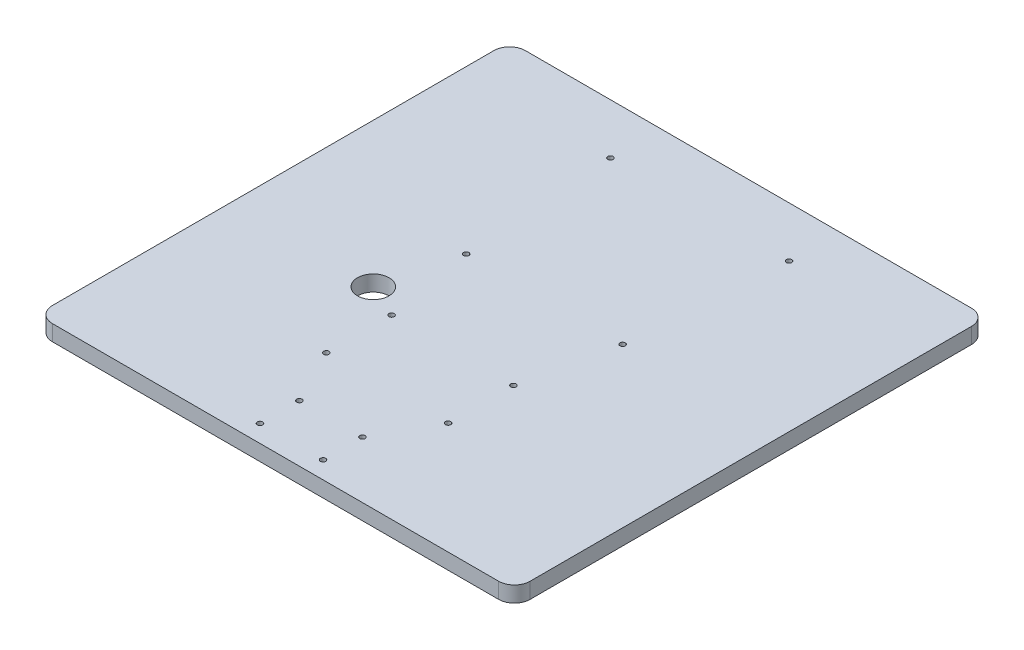
from build123d import *

# Parameters (mm, degrees)
SKETCH1_W                = 303
SKETCH1_H                = 300
BASE_FLANGE1_DEPTH       = 10
FILLET1_R                = 10
M3_CLEARANCE_HOLE1_D     = 3.4
M3_CLEARANCE_HOLE1_DEPTH = 50
M3_CLEARANCE_HOLE1_TIP   = 1.021463052
M3_CLEARANCE_HOLE2_D     = 3.4
M3_CLEARANCE_HOLE2_DEPTH = 28.71
M3_CLEARANCE_HOLE2_TIP   = 1.021463052
WIREHOLE_R               = 10
CUT_EXTRUDE1_DEPTH       = 10
M3_CLEARANCE_HOLE3_D     = 3.4
M3_CLEARANCE_HOLE3_DEPTH = 28.71
M3_CLEARANCE_HOLE3_TIP   = 1.021463052


# Sheet-metal steps are written as plain solids
with BuildPart() as part:
    # Sketch1 → Base-Flange1 (new body)
    with BuildSketch(Plane(origin=(0, 0, 0), x_dir=(1, 0, 0), z_dir=(0, 1, 0))):
        with Locations((151.5, 150)):
            Rectangle(SKETCH1_W, SKETCH1_H)
    extrude(amount=-BASE_FLANGE1_DEPTH)

    # Fillet1
    fillet1_edges = [part.edges().sort_by_distance(p)[0] for p in [
        (0, -5, -300),
        (303, -5, -300),
        (303, -5, 0),
        (0, -5, 0),
    ]]
    fillet(fillet1_edges, radius=FILLET1_R)

    # M3 Clearance Hole1
    with Locations(Plane(origin=(0, 0, 0), x_dir=(1, 0, 0), z_dir=(0, 1, 0))):
        with Locations((202.2366, 169.469739333), (102.9732, 169.469739333), (95.9732, 267.996539333), (209.2366, 267.996539333)):
            Hole(M3_CLEARANCE_HOLE1_D / 2, depth=M3_CLEARANCE_HOLE1_DEPTH)
            with Locations((0, 0, -(M3_CLEARANCE_HOLE1_DEPTH + M3_CLEARANCE_HOLE1_TIP / 2))):  # 118° drill point
                Cone(0, M3_CLEARANCE_HOLE1_D / 2, M3_CLEARANCE_HOLE1_TIP, mode=Mode.SUBTRACT)

    # M3 Clearance Hole2
    with Locations(Plane(origin=(0, 0, 0), x_dir=(1, 0, 0), z_dir=(0, 1, 0))):
        with Locations((130.625, 11), (170.625, 11), (130.625, 36), (170.625, 36)):
            Hole(M3_CLEARANCE_HOLE2_D / 2, depth=M3_CLEARANCE_HOLE2_DEPTH)
            with Locations((0, 0, -(M3_CLEARANCE_HOLE2_DEPTH + M3_CLEARANCE_HOLE2_TIP / 2))):  # 118° drill point
                Cone(0, M3_CLEARANCE_HOLE2_D / 2, M3_CLEARANCE_HOLE2_TIP, mode=Mode.SUBTRACT)

    # WireHole → Cut-Extrude1 (cut)
    with BuildSketch(Plane(origin=(0, 0, 0), x_dir=(1, 0, 0), z_dir=(0, 1, 0))):
        with Locations(Location((91.5, 122, 0), (0, 0, 270))):
            Circle(WIREHOLE_R)
    extrude(amount=-CUT_EXTRUDE1_DEPTH, mode=Mode.SUBTRACT)

    # M3 Clearance Hole3
    with Locations(Plane(origin=(0, 0, 0), x_dir=(1, 0, 0), z_dir=(0, 1, 0))):
        with Locations((190.15, 70.852), (190.15, 112.248), (112.86, 70.852), (112.86, 112.248)):
            Hole(M3_CLEARANCE_HOLE3_D / 2, depth=M3_CLEARANCE_HOLE3_DEPTH)
            with Locations((0, 0, -(M3_CLEARANCE_HOLE3_DEPTH + M3_CLEARANCE_HOLE3_TIP / 2))):  # 118° drill point
                Cone(0, M3_CLEARANCE_HOLE3_D / 2, M3_CLEARANCE_HOLE3_TIP, mode=Mode.SUBTRACT)


solid = part.part
